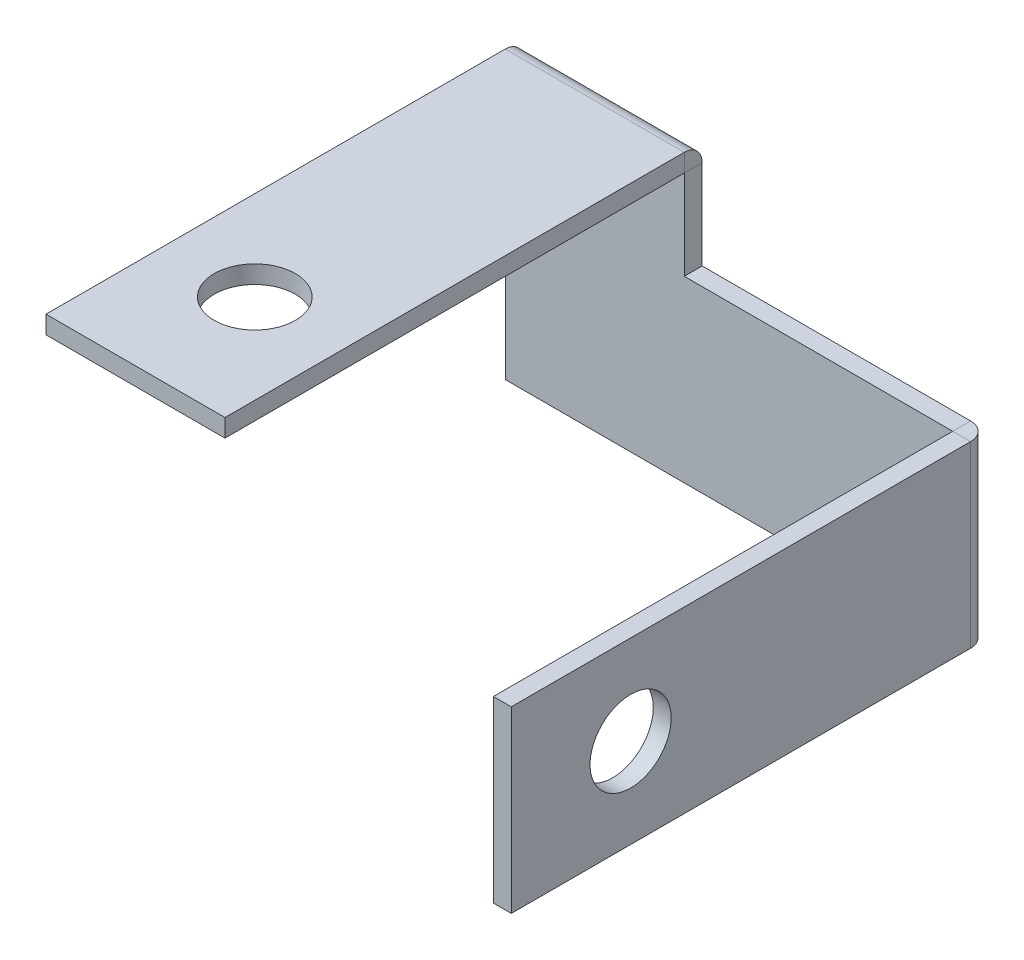
from build123d import *

# Parameters (mm, degrees)
BASE_FLANGIA1_DEPTH             = 1.5
BORDO_FLANGIA1_START            = -24
BORDO_FLANGIA1_OUTLINE_W        = 1.5
BORDO_FLANGIA1_OUTLINE_H        = 38.5
BORDO_FLANGIA1_DEPTH            = 15
BORDO_FLANGIA1_START_2          = -15
BORDO_FLANGIA1_2_OUTLINE_W      = 1.5
BORDO_FLANGIA1_2_OUTLINE_H      = 38.5
BORDO_FLANGIA1_2_DEPTH          = 15
BORDO_FLANGIA1_3_DEPTH          = 15
BORDO_FLANGIA1_4_DEPTH          = 15
FORO_FILETTATO_M8_1_D           = 6.8
FORO_FILETTATO_M8_1_ON_FACE_2_D = 6.8


# Read off the part's stored shape, not the designer's step: Schizzo10
# Sheet-metal steps are written as plain solids
with BuildPart() as part:
    # Schizzo1 → Base-Flangia1 (new body)
    with BuildSketch(Plane.XY):
        Polygon((0, 0), (0, 9), (-15, 9), (-15, -15), (24, -15), (24, 0), align=None)
    extrude(amount=-BASE_FLANGIA1_DEPTH)

    # Bordo-Flangia1 outline → Bordo-Flangia1 (add)
    with BuildSketch(Plane(origin=(0, 9, 0), x_dir=(-1, 0, 0), z_dir=(0, 1, 0)).offset(BORDO_FLANGIA1_START)):
        with Locations((-23.25, 19.25)):
            Rectangle(BORDO_FLANGIA1_OUTLINE_W, BORDO_FLANGIA1_OUTLINE_H)
    extrude(amount=BORDO_FLANGIA1_DEPTH)

    # Bordo-Flangia1 2 outline → Bordo-Flangia1 2 (add)
    with BuildSketch(Plane.YZ.offset(BORDO_FLANGIA1_START_2)):
        with Locations((8.25, 19.25)):
            Rectangle(BORDO_FLANGIA1_2_OUTLINE_W, BORDO_FLANGIA1_2_OUTLINE_H)
    extrude(amount=BORDO_FLANGIA1_2_DEPTH)

    # Bordo-Flangia1 3 outline → Bordo-Flangia1 3 (cut)
    with BuildSketch(Plane(origin=(0, 9, 0), x_dir=(-1, 0, 0), z_dir=(0, 1, 0)).offset(BORDO_FLANGIA1_START)):
        with BuildLine():
            ThreePointArc((-22.5, -1.5), (-23.560660172, -1.060660172), (-24, 0))
            Line((-24, 0), (-24, -1.5))
            Line((-24, -1.5), (-22.5, -1.5))
        make_face()
    extrude(amount=BORDO_FLANGIA1_3_DEPTH, mode=Mode.SUBTRACT)

    # Bordo-Flangia1 4 outline → Bordo-Flangia1 4 (cut)
    with BuildSketch(Plane.YZ.offset(BORDO_FLANGIA1_START_2)):
        with BuildLine():
            ThreePointArc((9, 0), (8.560660172, -1.060660172), (7.5, -1.5))
            Line((7.5, -1.5), (9, -1.5))
            Line((9, -1.5), (9, 0))
        make_face()
    extrude(amount=BORDO_FLANGIA1_4_DEPTH, mode=Mode.SUBTRACT)

    # Foro filettato M8-1 (through all)
    with Locations(Plane(origin=(-7.5, 9, 28.5), x_dir=(0, 0, 1), z_dir=(0, 1, 0))):
        with Locations((0, 0)):
            Hole(FORO_FILETTATO_M8_1_D / 2)

    # Foro filettato M8-1 on face 2 (through all)
    with Locations(Plane(origin=(24, -7.5, 28.5), x_dir=(0, 0, 1), z_dir=(1, 0, 0))):
        with Locations((0, 0)):
            Hole(FORO_FILETTATO_M8_1_ON_FACE_2_D / 2)


solid = part.part
